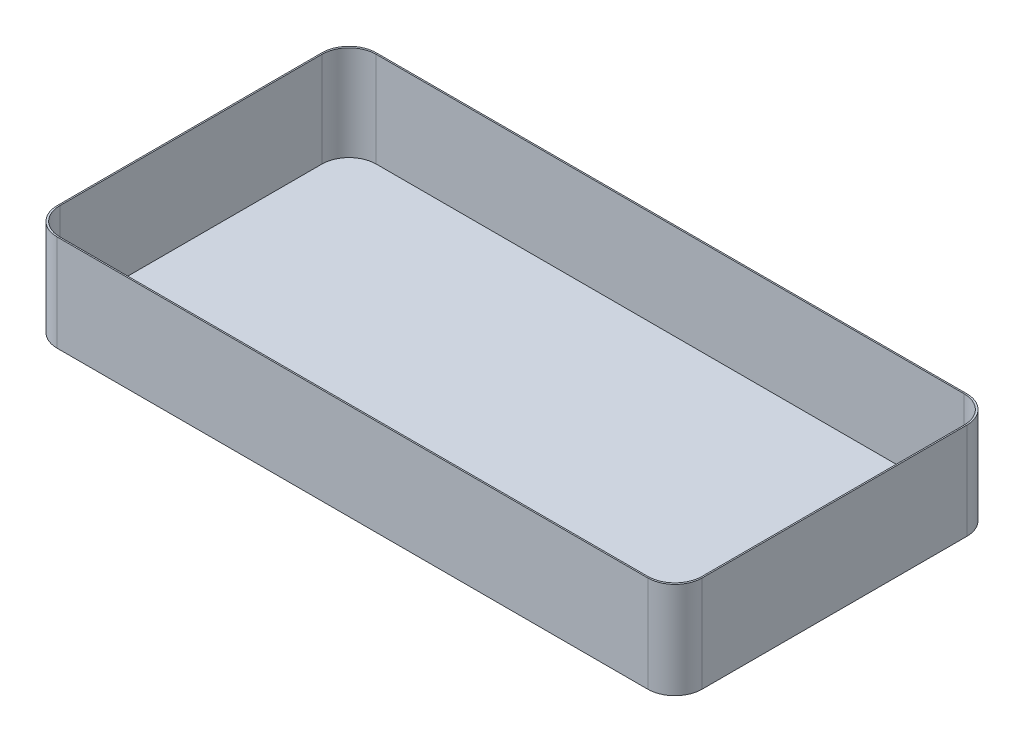
from build123d import *

# Parameters (mm, degrees)
SKETCH1_W           = 1206.5
SKETCH1_H           = 596.9
SKETCH1_W_2         = 1201.42
SKETCH1_H_2         = 591.82
BOSS_EXTRUDE1_DEPTH = 177.8
SKETCH2_W           = 1206.5
SKETCH2_H           = 596.9
BOSS_EXTRUDE2_DEPTH = 2.54
FILLET1_R           = 50.8


with BuildPart() as part:
    # Sketch1 → Boss-Extrude1 (new body)
    with BuildSketch(Plane(origin=(0, 0, 0), x_dir=(1, 0, 0), z_dir=(0, 1, 0))):
        Rectangle(SKETCH1_W, SKETCH1_H)
        Rectangle(SKETCH1_W_2, SKETCH1_H_2, mode=Mode.SUBTRACT)
    extrude(amount=BOSS_EXTRUDE1_DEPTH)

    # Sketch2 → Boss-Extrude2 (add)
    with BuildSketch(Plane.XZ):
        Rectangle(SKETCH2_W, SKETCH2_H)
    extrude(amount=BOSS_EXTRUDE2_DEPTH)

    # Fillet1
    fillet1_edges = [part.edges().sort_by_distance(p)[0] for p in [
        (600.71, 88.9, 295.91),
        (-600.71, 88.9, 295.91),
        (-600.71, 88.9, -295.91),
        (600.71, 88.9, -295.91),
        (603.25, 87.63, -298.45),
        (603.25, 87.63, 298.45),
        (-603.25, 87.63, 298.45),
        (-603.25, 87.63, -298.45),
    ]]
    fillet(fillet1_edges, radius=FILLET1_R)


solid = part.part
